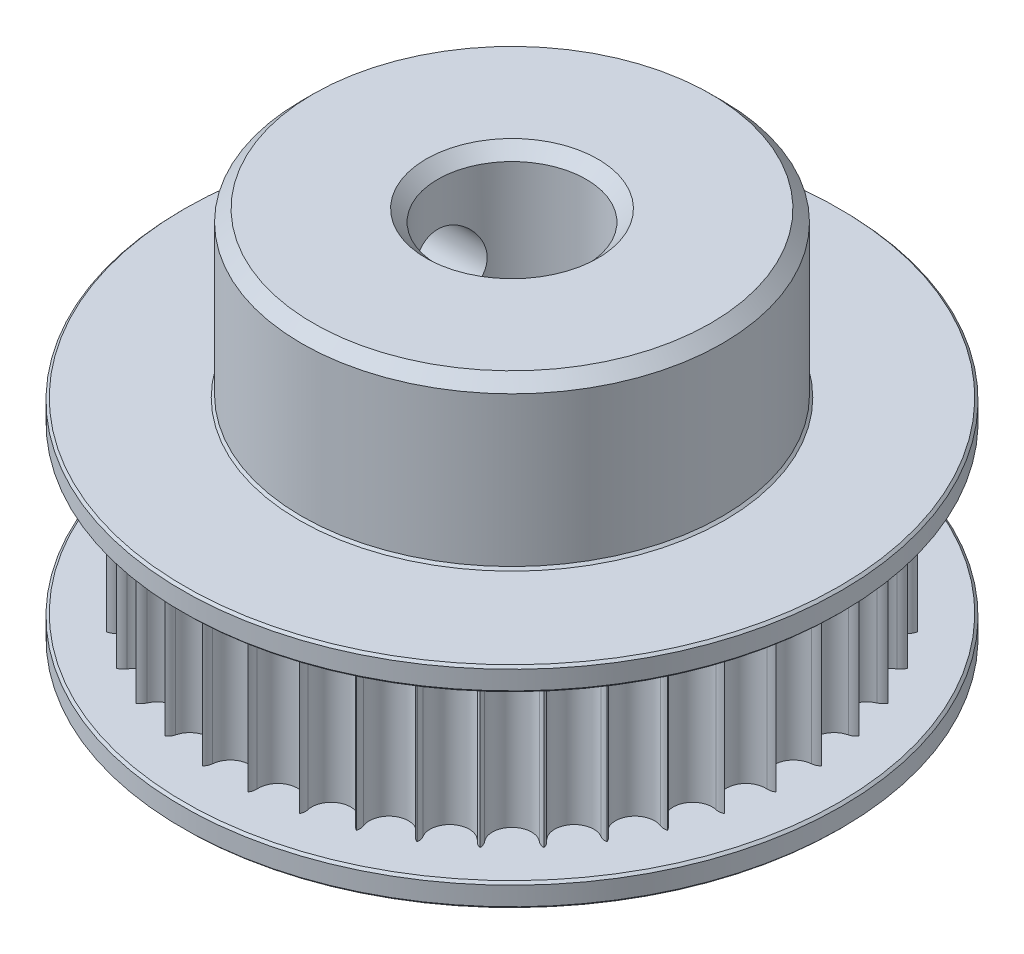
from build123d import *

# Parameters (mm, degrees)
CUT_EXTRUDE3_DEPTH      = 7
CIRPATTERN1_COUNT       = 40
CUT_EXTRUDE2_REACH      = 23.676
CUT_EXTRUDE2_END_RADIUS = 9
SKETCH3_R               = 1.65
CHAMFER1_SIZE           = 1
CHAMFER2_SIZE           = 0.5
CHAMFER3_SIZE           = 0.1


with BuildPart() as part:
    # Skica2 → Revolute (revolve)
    with BuildSketch(Plane.XY):
        Polygon((9, 8.5), (3.175, 8.5), (3.175, -8.5), (6.11, -8.5), (6.11, -7.5), (14.1, -7.5), (14.1, -6.5), (12.5, -6.5), (12.5, 0.5), (14.1, 0.5), (14.1, 1.5), (9, 1.5), align=None)
    revolve(axis=Axis((0, -8.5, 0), (0, 1, 0)))

    # Sketch2 → Cut-Extrude3 (cut)
    with BuildSketch(Plane.XZ.offset(-0.5)):
        with BuildLine():
            ThreePointArc((-0.832572418, 11.97108279), (0, 11.210469025), (0.832572418, 11.97108279))
            ThreePointArc((0.832572418, 11.97108279), (1.014312712, 12.313309772), (1.385975582, 12.422925247))
            ThreePointArc((1.385975582, 12.422925247), (1.771675151, 12.373809727), (2.155660572, 12.312722181))
            ThreePointArc((2.155660572, 12.312722181), (1.541189214, 13.740623371), (0, 13.943632401))
            ThreePointArc((0, 13.943632401), (-1.541189214, 13.740623371), (-2.155660572, 12.312722181))
            ThreePointArc((-2.155660572, 12.312722181), (-1.771675151, 12.373809727), (-1.385975582, 12.422925247))
            ThreePointArc((-1.385975582, 12.422925247), (-1.014312712, 12.313309772), (-0.832572418, 11.97108279))
        make_face()
    cut_extrude3 = extrude(amount=CUT_EXTRUDE3_DEPTH, mode=Mode.SUBTRACT)

    # CirPattern1: Cut-Extrude3 ×40 about axis
    cirpattern1_axis = Axis((0, 0, 0), (0, 1, 0))
    for i in range(1, CIRPATTERN1_COUNT):
        add(cut_extrude3.rotate(cirpattern1_axis, i * 360 / CIRPATTERN1_COUNT), mode=Mode.SUBTRACT)

    # Cut-Extrude2: up to this cylinder (the profile starts inside it)
    cut_extrude2_end = Plane(origin=(0, 4.5, 0), z_dir=(0, -1, 0)) * Cylinder(CUT_EXTRUDE2_END_RADIUS, 66.352, mode=Mode.PRIVATE)
    # Sketch3 → Cut-Extrude2 (cut, up to the surface)
    with BuildSketch(Plane(origin=(0, 0, 0), x_dir=(0, 0, -1), z_dir=(1, 0, 0)), mode=Mode.PRIVATE) as cut_extrude2_sk1:
        with Locations((0, 4.5)):
            Circle(SKETCH3_R)
    cut_extrude2_tool1 = extrude(cut_extrude2_sk1.sketch, amount=-CUT_EXTRUDE2_REACH, mode=Mode.PRIVATE) & cut_extrude2_end
    add(cut_extrude2_tool1.solids().sort_by_distance((0, 4.5, 0))[0], mode=Mode.SUBTRACT)

    # Chamfer1
    chamfer1_edges = [part.edges().sort_by_distance(p)[0] for p in [
        (-6.11, -7.5, 0),
    ]]
    chamfer(chamfer1_edges, length=CHAMFER1_SIZE - 0.0001)  # a hair under: the kernel refuses the full size

    # Chamfer2
    chamfer2_edges = [part.edges().sort_by_distance(p)[0] for p in [
        (-3.175, 8.5, 0),
        (-9, 8.5, 0),
    ]]
    chamfer(chamfer2_edges, length=CHAMFER2_SIZE)

    # Chamfer3
    chamfer3_edges = [part.edges().sort_by_distance(p)[0] for p in [
        (-14.1, 0.5, 0),
        (-14.1, -6.5, 0),
        (-14.1, -7.5, 0),
        (-9, 1.5, 0),
        (-14.1, 1.5, 0),
    ]]
    chamfer(chamfer3_edges, length=CHAMFER3_SIZE)


solid = part.part
